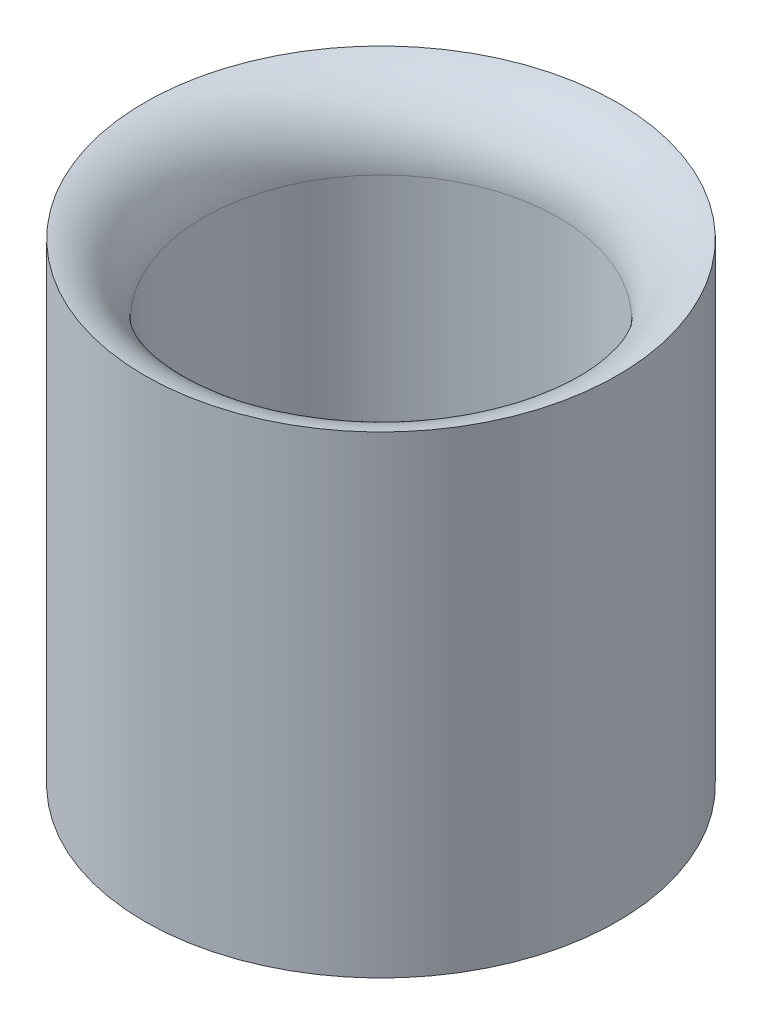
from build123d import *

# Parameters (mm, degrees)
SKETCH1_R           = 10
BOSS_EXTRUDE1_DEPTH = 20
CUT_EXTRUDE1_REACH  = 26.495
SKETCH2_R           = 7.5
FILLET1_R           = 3


with BuildPart() as part:
    # Sketch1 → Boss-Extrude1 (new body)
    with BuildSketch(Plane(origin=(0, 0, 0), x_dir=(1, 0, 0), z_dir=(0, 1, 0))):
        with Locations(Location((0, 0, 0), (0, 0, 270))):
            Circle(SKETCH1_R)
    extrude(amount=BOSS_EXTRUDE1_DEPTH)

    # Sketch2 → Cut-Extrude1 (cut, up to next)
    with BuildSketch(Plane(origin=(0, 20, 0), x_dir=(1, 0, 0), z_dir=(0, 1, 0)), mode=Mode.PRIVATE) as cut_extrude1_sk1:
        with Locations(Location((0, 0, 0), (0, 0, 270))):
            Circle(SKETCH2_R)
    cut_extrude1_tool1 = extrude(cut_extrude1_sk1.sketch, amount=-CUT_EXTRUDE1_REACH, mode=Mode.PRIVATE) & part.part
    add(cut_extrude1_tool1.solids().sort_by_distance((0, 20, 0))[0], mode=Mode.SUBTRACT)

    # Fillet1
    # the kernel refuses this fillet: 3 mm, written as the material it takes off along each edge
    with BuildSketch(Plane(origin=(0, 20, 0), x_dir=(-1.8e-16, 0, 1), z_dir=(-1, 0, -1.8e-16))) as fillet1_piece_1:
        with BuildLine():
            CenterArc((10.5, -2.958039891550115), FILLET1_R, 99.5940682268595, 80.4059317731405)
            Line((7.5, -2.958039891550115), (7.44, -2.958039891550115))
            Line((7.44, -2.958039891550115), (7.44, 0))
            Line((7.44, 0), (7.5, 0.05999999999999872))
            ThreePointArc((7.5, 0.05999999999999872), (8.750000000000025, 0.05999999999999872), (9.99000000000005, 0.05916079783069961))
            Line((9.99000000000005, 0.05916079783069961), (10.00000000000005, -2.9843e-13))
        make_face()
    revolve(axis=Axis((0, 20, 0), (0, 1, 0)), mode=Mode.SUBTRACT)


solid = part.part
